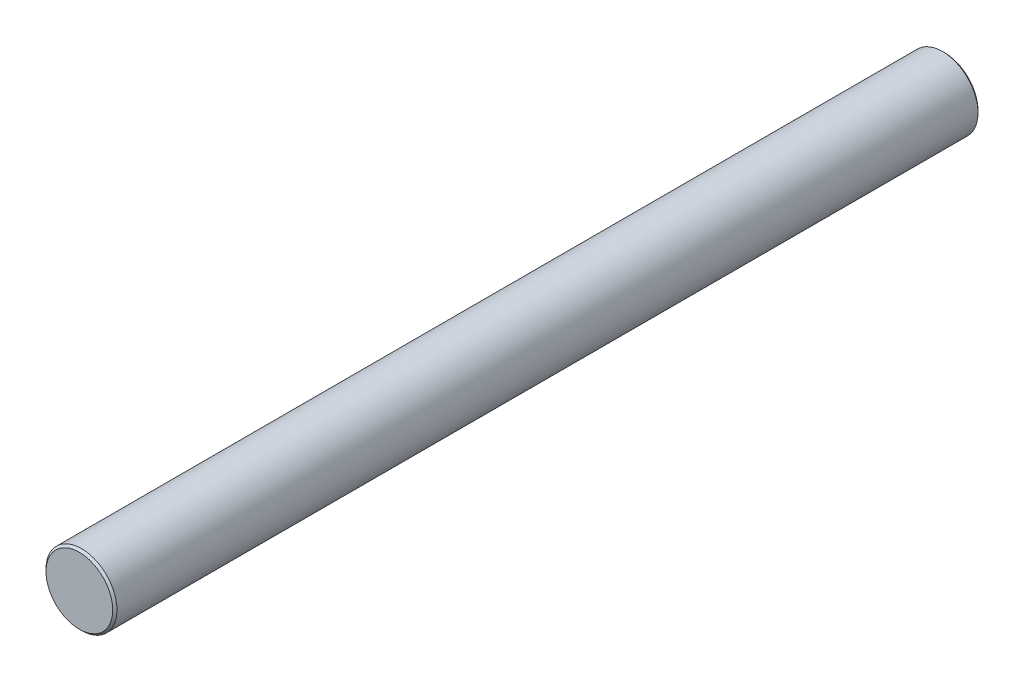
from build123d import *

# Parameters (mm, degrees)
SKETCH2_W     = 304.8
SKETCH2_H     = 12.5
CHAMFER1_SIZE = 0.75


with BuildPart() as part:
    # Sketch2 → Revolve1 (revolve)
    with BuildSketch(Plane(origin=(0, 0, 0), x_dir=(0, 0, -1), z_dir=(1, 0, 0))):
        with Locations((0, 6.25)):
            Rectangle(SKETCH2_W, SKETCH2_H)
    revolve(axis=Axis((0, 0, -152.4), (0, 0, 1)))

    # Chamfer1
    chamfer1_edges = [part.edges().sort_by_distance(p)[0] for p in [
        (0, -12.5, -152.4),
        (0, -12.5, 152.4),
    ]]
    chamfer(chamfer1_edges, length=CHAMFER1_SIZE)


solid = part.part
